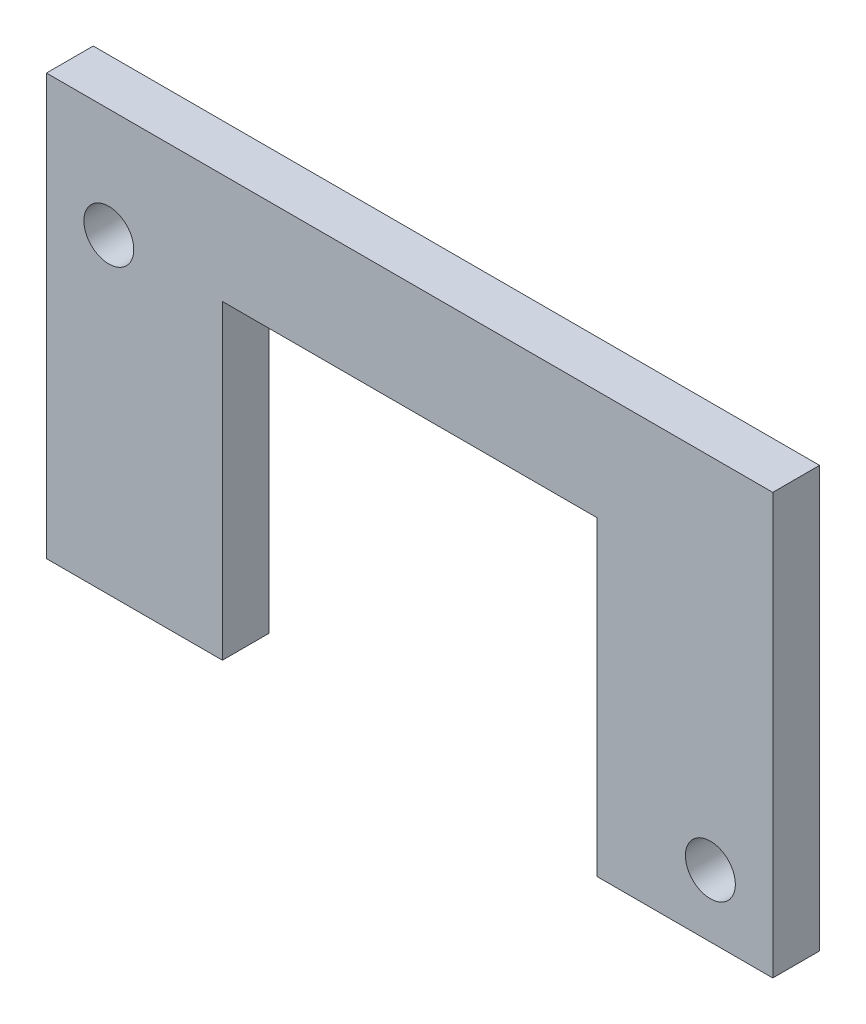
from build123d import *

# Parameters (mm, degrees)
SKETCH1_W           = 36.957
SKETCH1_H           = 21.3995
SKETCH1_R           = 1.27
BOSS_EXTRUDE1_DEPTH = 2.38125
CUT_EXTRUDE1_REACH  = 42.61
SKETCH2_W           = 19.05
SKETCH2_H           = 15.8115


with BuildPart() as part:
    # Sketch1 → Boss-Extrude1 (new body)
    with BuildSketch(Plane.XY):
        with Locations((16.891, 9.11225)):
            Rectangle(SKETCH1_W, SKETCH1_H)
        with Locations((1.5875, 14.25575)):
            Circle(SKETCH1_R, mode=Mode.SUBTRACT)
        with Locations((32.1945, 1.5875)):
            Circle(SKETCH1_R, mode=Mode.SUBTRACT)
    extrude(amount=BOSS_EXTRUDE1_DEPTH)

    # Sketch2 → Cut-Extrude1 (cut, up to next)
    with BuildSketch(Plane.XY.offset(2.38125), mode=Mode.PRIVATE) as cut_extrude1_sk1:
        with Locations((16.891, 6.31825)):
            Rectangle(SKETCH2_W, SKETCH2_H)
    cut_extrude1_tool1 = extrude(cut_extrude1_sk1.sketch, amount=-CUT_EXTRUDE1_REACH, mode=Mode.PRIVATE) & part.part
    add(cut_extrude1_tool1.solids().sort_by_distance((16.891, 6.31825, 2.38125))[0], mode=Mode.SUBTRACT)


solid = part.part
